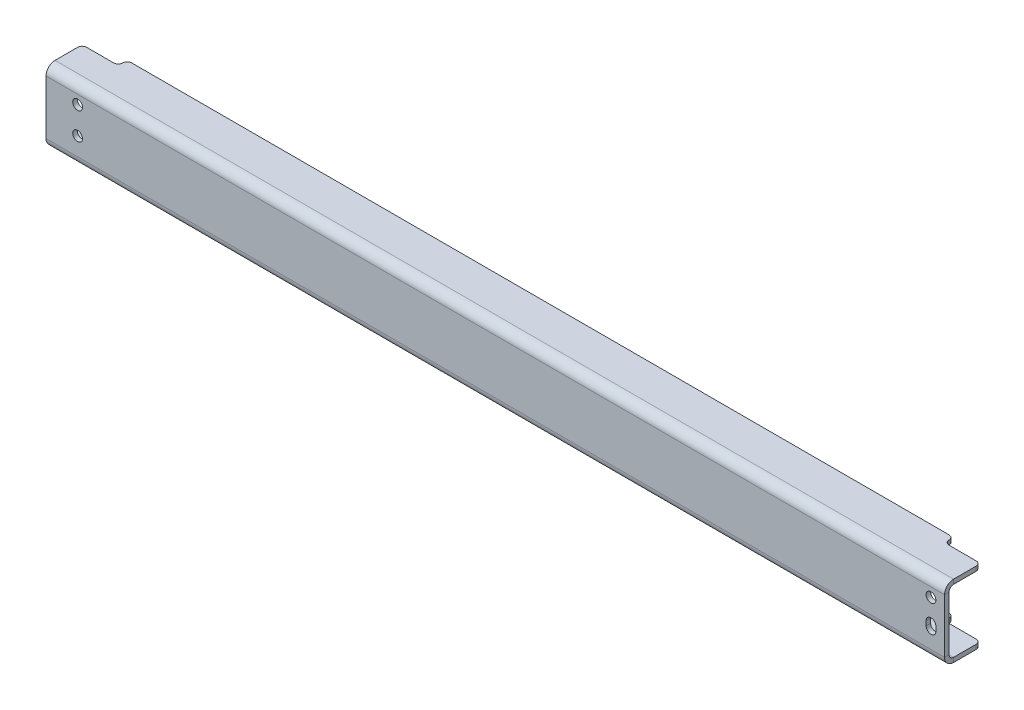
from build123d import *

# Parameters (mm, degrees)
BASE_FLANGE1_DEPTH = 631.825
SKETCH2_W          = 25.4
SKETCH2_H          = 6.35
CUT_EXTRUDE1_DEPTH = 50.8
SKETCH3_R          = 3.429
CUT_EXTRUDE2_DEPTH = 3.175
FILLET1_R          = 3.175
SKETCH4_R          = 7.9375
CUT_EXTRUDE3_DEPTH = 3.175


# Sheet-metal steps are written as plain solids
with BuildPart() as part:
    # Sketch1 → Base-Flange1 (new body)
    with BuildSketch(Plane(origin=(0, 0, 0), x_dir=(0, 0, -1), z_dir=(1, 0, 0))):
        with BuildLine():
            Line((31.75, 50.8), (6.35, 50.8))
            ThreePointArc((6.35, 50.8), (1.859871939, 48.940128061), (0, 44.45))
            Line((0, 44.45), (0, 6.35))
            ThreePointArc((0, 6.35), (1.859871939, 1.859871939), (6.35, 0))
            Line((6.35, 0), (31.75, 0))
            Line((31.75, 0), (31.75, 3.175))
            Line((31.75, 3.175), (6.35, 3.175))
            ThreePointArc((6.35, 3.175), (4.10493597, 4.10493597), (3.175, 6.35))
            Line((3.175, 6.35), (3.175, 44.45))
            ThreePointArc((3.175, 44.45), (4.10493597, 46.69506403), (6.35, 47.625))
            Line((6.35, 47.625), (31.75, 47.625))
            Line((31.75, 47.625), (31.75, 50.8))
        make_face()
    extrude(amount=BASE_FLANGE1_DEPTH)

    # Sketch2 → Cut-Extrude1 (cut)
    with BuildSketch(Plane(origin=(0, 50.8, 0), x_dir=(1, 0, 0), z_dir=(0, 1, 0))):
        with Locations((12.7, 28.575)):
            Rectangle(SKETCH2_W, SKETCH2_H)
        with Locations((619.125, 28.575)):
            Rectangle(SKETCH2_W, SKETCH2_H)
    extrude(amount=-CUT_EXTRUDE1_DEPTH, mode=Mode.SUBTRACT)

    # Sketch3 → Cut-Extrude2 (cut)
    with BuildSketch(Plane.XY):
        with Locations((22.225, 19.05)):
            Circle(SKETCH3_R)
        with Locations((22.225, 38.1)):
            Circle(SKETCH3_R)
        with Locations((622.3, 38.1)):
            Circle(SKETCH3_R)
        with BuildLine():
            Line((618.871, 22.225), (618.871, 19.05))
            ThreePointArc((618.871, 19.05), (622.3, 15.621), (625.729, 19.05))
            Line((625.729, 19.05), (625.729, 22.225))
            ThreePointArc((625.729, 22.225), (622.3, 25.654), (618.871, 22.225))
        make_face()
    extrude(amount=-CUT_EXTRUDE2_DEPTH, mode=Mode.SUBTRACT)

    # Fillet1
    fillet1_edges = [part.edges().sort_by_distance(p)[0] for p in [
        (0, 49.2125, -25.4),
        (25.4, 49.2125, -31.75),
        (0, 1.5875, -25.4),
        (25.4, 1.5875, -31.75),
        (606.425, 1.5875, -31.75),
        (606.425, 49.2125, -31.75),
        (631.825, 1.5875, -25.4),
        (631.825, 49.2125, -25.4),
        (606.425, 1.5875, -25.4),
        (606.425, 49.2125, -25.4),
        (25.4, 1.5875, -25.4),
        (25.4, 49.2125, -25.4),
    ]]
    fillet(fillet1_edges, radius=FILLET1_R - 0.0001)  # a hair under: the kernel refuses the full size

    # Sketch4 → Cut-Extrude3 (cut)
    with BuildSketch(Plane.XZ):
        with Locations(Location((41.275, -20.6375, 0), (0, 0, 270))):
            Circle(SKETCH4_R)
    extrude(amount=-CUT_EXTRUDE3_DEPTH, mode=Mode.SUBTRACT)


solid = part.part
